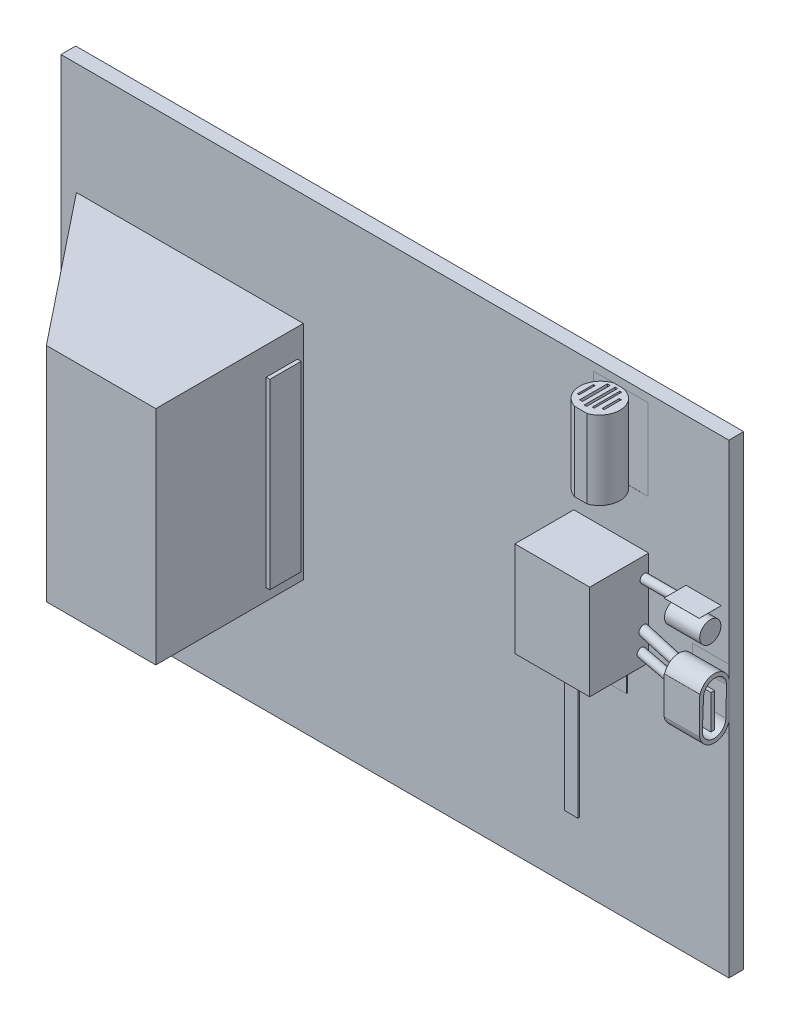
from build123d import *

# Parameters (mm, degrees)
SKETCH1_W            = 86.26612282
SKETCH1_H            = 57.862502499
BOSS_EXTRUDE1_DEPTH  = 5
SKETCH2_W            = 36.260872389
SKETCH2_H            = 45.239555314
SKETCH2_W_2          = 34.782772322
SKETCH2_H_2          = 43.550253841
BOSS_EXTRUDE2_DEPTH  = 1
SKETCH3_R            = 3.560103521
BOSS_EXTRUDE3_DEPTH  = 1
CUT_EXTRUDE2_DEPTH   = 0.5
CUT_EXTRUDE3_DEPTH   = 0.5
SKETCH11_W           = 90.581934504
SKETCH11_H           = 63.169878757
BOSS_EXTRUDE4_DEPTH  = 2
CUT_EXTRUDE11_DEPTH  = 101.321804273
CUT_EXTRUDE15_DEPTH  = 103.919917714
CUT_EXTRUDE18_DEPTH  = 107.173317368
CUT_EXTRUDE21_DEPTH  = 107.173317368
SKETCH22_W           = 30.768629045
SKETCH22_H           = 30.108187039
BOSS_EXTRUDE9_DEPTH  = 20
CUT_EXTRUDE25_DEPTH  = 30
SKETCH24_W           = 10.403591378
SKETCH24_H           = 24.347234515
CUT_EXTRUDE27_DEPTH  = 7
CUT_EXTRUDE29_DEPTH  = 101.055879455
BOSS_EXTRUDE12_DEPTH = 0.5
CUT_EXTRUDE30_DEPTH  = 0.5
SKETCH28_W           = 4.24318125
SKETCH28_H           = 24.719707094
BOSS_EXTRUDE13_DEPTH = 0.5
BOSS_EXTRUDE14_DEPTH = 0.5
BOSS_EXTRUDE15_DEPTH = 0.5
BOSS_EXTRUDE16_DEPTH = 0.5
BOSS_EXTRUDE17_DEPTH = 0.5
BOSS_EXTRUDE18_DEPTH = 0.5
BOSS_EXTRUDE19_DEPTH = 0.5
SKETCH37_W           = 4.809361554
SKETCH37_H           = 8.223826382
BOSS_EXTRUDE20_DEPTH = 4
CUT_EXTRUDE31_DEPTH  = 5
CUT_EXTRUDE32_DEPTH  = 5
CUT_EXTRUDE33_DEPTH  = 4
BOSS_EXTRUDE21_DEPTH = 4
SKETCH45_W           = 7.393024126
SKETCH45_H           = 10.623672207
BOSS_EXTRUDE24_DEPTH = 5.4
CUT_EXTRUDE47_DEPTH  = 11
CUT_EXTRUDE48_DEPTH  = 11
SKETCH55_W           = 0.338760224
SKETCH55_H           = 4.197398105
SKETCH55_W_2         = 0.38659999
SKETCH55_H_2         = 3.75171778
SKETCH55_W_3         = 0.23603713
SKETCH55_H_3         = 2.17599611
SKETCH55_W_4         = 0.254598772
SKETCH55_W_5         = 0.28217667
SKETCH55_H_4         = 2.328822457
CUT_EXTRUDE49_DEPTH  = 2
SKETCH57_W           = 4.777558033
SKETCH57_H           = 4.41992938
BOSS_EXTRUDE25_DEPTH = 3
SKETCH58_W           = 10.154057581
SKETCH58_H           = 12.884826261
BOSS_EXTRUDE26_DEPTH = 8
SKETCH60_R           = 1.436812087
CUT_EXTRUDE50_DEPTH  = 5
SKETCH65_R           = 0.579919863
SKETCH64_R           = 0.652076924
BOSS_EXTRUDE27_DEPTH = 18
SKETCH67_W           = 2.480807215
SKETCH67_H           = 0.144524976
BOSS_EXTRUDE28_DEPTH = 5
SKETCH68_R           = 0.578982331


with BuildPart() as part:
    # Sketch1 → Boss-Extrude1 (new body)
    with BuildSketch(Plane.XY):
        with Locations((-40.563374765, -16.351878859)):
            Rectangle(SKETCH1_W, SKETCH1_H)
    extrude(amount=BOSS_EXTRUDE1_DEPTH)

    # Sketch2 → Boss-Extrude2 (add)
    with BuildSketch(Plane(origin=(0, 0, 0), x_dir=(-1, 0, 0), z_dir=(0, 0, -1))):
        with Locations((32.418116178, -15.92763049)):
            Rectangle(SKETCH2_W, SKETCH2_H)
        with Locations((32.418116178, -15.92763049)):
            Rectangle(SKETCH2_W_2, SKETCH2_H_2, mode=Mode.SUBTRACT)
    extrude(amount=BOSS_EXTRUDE2_DEPTH)

    # Sketch3 → Boss-Extrude3 (add)
    with BuildSketch(Plane(origin=(0, 0, 0), x_dir=(-1, 0, 0), z_dir=(0, 0, -1))):
        with Locations((5.84715491, -15.809376146)):
            Circle(SKETCH3_R)
    extrude(amount=BOSS_EXTRUDE3_DEPTH)

    # Sketch4 → Cut-Extrude2 (cut)
    with BuildSketch(Plane(origin=(0, 0, -1), x_dir=(-1, 0, 0), z_dir=(0, 0, -1))):
        with BuildLine():
            Line((7.498244586, -13.503730374), (7.429945817, -14.22683494))
            ThreePointArc((7.429945817, -14.22683494), (3.750240849, -15.79486572), (7.319195969, -17.600830429))
            Line((7.319195969, -17.600830429), (7.313770936, -18.341402976))
            ThreePointArc((7.313770936, -18.341402976), (3.134365244, -15.759677296), (7.498244586, -13.503730374))
        make_face()
    extrude(amount=-CUT_EXTRUDE2_DEPTH, mode=Mode.SUBTRACT)

    # Sketch5 → Cut-Extrude3 (cut)
    with BuildSketch(Plane(origin=(0, 0, -1), x_dir=(-1, 0, 0), z_dir=(0, 0, -1))):
        with BuildLine():
            Line((8.340052895, -15.49291333), (5.46397868, -15.438165983))
            ThreePointArc((5.46397868, -15.438165983), (5.066360432, -15.835784231), (5.46397868, -16.233402479))
            Line((5.46397868, -16.233402479), (8.340052895, -16.178655131))
            ThreePointArc((8.340052895, -16.178655131), (8.682923796, -15.835784231), (8.340052895, -15.49291333))
        make_face()
    extrude(amount=-CUT_EXTRUDE3_DEPTH, mode=Mode.SUBTRACT)

    # Sketch11 → Boss-Extrude4 (add)
    with BuildSketch(Plane.XY.offset(5)):
        with Locations((-39.758075886, -16.772300036)):
            Rectangle(SKETCH11_W, SKETCH11_H)
    extrude(amount=BOSS_EXTRUDE4_DEPTH)

    # Sketch12 → Cut-Extrude11 (cut, through all)
    with BuildSketch(Plane(origin=(2.569686645, 0, 0), x_dir=(0, 0, -1), z_dir=(1, 0, 0))):
        Polygon((-5.049502584, 12.555506791), (1.376837193, 8.637811028), (1.49491418, 17.884962826), align=None)
    extrude(amount=-CUT_EXTRUDE11_DEPTH, mode=Mode.SUBTRACT)

    # Sketch14 → Cut-Extrude15 (cut, through all)
    with BuildSketch(Plane.ZY.offset(85.049043138)):
        Polygon((5, -45.234938719), (-1.330755584, -41.178219973), (-1.62330097, -49.506029315), align=None)
    extrude(amount=-CUT_EXTRUDE15_DEPTH, mode=Mode.SUBTRACT)

    # Sketch15 → Cut-Extrude18 (cut, through all)
    with BuildSketch(Plane(origin=(0, -48.357239414, 0), x_dir=(-1, 0, 0), z_dir=(0, -1, 0))):
        Polygon((-2.559600043, -5), (1.778800488, 1.23954643), (-4.071250311, 1.127548689), align=None)
    extrude(amount=-CUT_EXTRUDE18_DEPTH, mode=Mode.SUBTRACT)

    # Sketch19 → Cut-Extrude21 (cut, through all)
    with BuildSketch(Plane(origin=(0, -48.357239414, 0), x_dir=(-1, 0, 0), z_dir=(0, -1, 0))):
        Polygon((83.717221886, -5), (87.274615215, 1.645442207), (78.528738966, 2.746914443), align=None)
    extrude(amount=-CUT_EXTRUDE21_DEPTH, mode=Mode.SUBTRACT)

    # Sketch22 → Boss-Extrude9 (add)
    with BuildSketch(Plane.XY.offset(7)):
        with Locations((-67.568283815, -15.397372948)):
            Rectangle(SKETCH22_W, SKETCH22_H)
    extrude(amount=BOSS_EXTRUDE9_DEPTH)

    # Sketch23 → Cut-Extrude25 (cut)
    with BuildSketch(Plane(origin=(-55.481529523, 0, -37.15866109), x_dir=(-0.5564715507955287, 0, 0.8308666638848977), z_dir=(-0.8308666638848977, 0, -0.5564715507955287))):
        Polygon((50.703232917, -28.437980679), (50.703232917, -4.339059459), (35.739273575, -4.339059459), (35.739273575, -28.68631805), align=None)
    extrude(amount=-CUT_EXTRUDE25_DEPTH, mode=Mode.SUBTRACT)

    # Sketch24 → Cut-Extrude27 (cut)
    with BuildSketch(Plane(origin=(0, 0, 0), x_dir=(-1, 0, 0), z_dir=(0, 0, -1))):
        with Locations((59.023003448, -16.512676716)):
            Rectangle(SKETCH24_W, SKETCH24_H)
    extrude(amount=-CUT_EXTRUDE27_DEPTH, mode=Mode.SUBTRACT)

    # Sketch25 → Cut-Extrude29 (cut, through all)
    with BuildSketch(Plane(origin=(0, -30.451466467, 0), x_dir=(-1, 0, 0), z_dir=(0, -1, 0))):
        Polygon((67.027013916, -27), (82.952598337, -7), (82.952598337, -27), align=None)
    extrude(amount=-CUT_EXTRUDE29_DEPTH, mode=Mode.SUBTRACT)

    # Sketch26 → Boss-Extrude12 (add)
    with BuildSketch(Plane(origin=(-28.214906652, 0, 42.127625982), x_dir=(-0.8308666638848977, 0, -0.5564715507955287), z_dir=(0.5564715507955287, 0, -0.8308666638848977))):
        Polygon((51.419951496, -27.042584084), (54.706101089, -26.949653395), (56.786873834, -24.75229922), (56.786873834, -21.375630671), (54.37614932, -19.775708176), (51.378991837, -19.979195935), (49.113437408, -21.947725891), (49.198141766, -24.942981754), align=None)
    extrude(amount=BOSS_EXTRUDE12_DEPTH)

    # Sketch27 → Cut-Extrude30 (cut)
    with BuildSketch(Plane(origin=(-27.936670877, 0, 41.71219265), x_dir=(-0.8308666638848977, 0, -0.5564715507955287), z_dir=(0.5564715507955287, 0, -0.8308666638848977))):
        Polygon((54.464642231, -26.33422033), (51.646822703, -26.4613127), (49.783754686, -24.759052026), (49.783754686, -22.033008306), (51.488432075, -20.626662945), (54.098721897, -20.567022016), (56.163922733, -21.70417842), (56.231939561, -24.681054163), align=None)
        Polygon((54.320245459, -25.718387713), (51.727557218, -25.777626474), (50.570422247, -24.540605306), (50.46279432, -22.1543403), (51.442527772, -21.237877536), (54.013268601, -21.237877536), (55.47502107, -22.062626752), (55.47502107, -24.540605306), align=None, mode=Mode.SUBTRACT)
    extrude(amount=-CUT_EXTRUDE30_DEPTH, mode=Mode.SUBTRACT)

    # Sketch28 → Boss-Extrude13 (add)
    with BuildSketch(Plane(origin=(-52.183969292, 0, 0), x_dir=(0, 0, -1), z_dir=(1, 0, 0))):
        with Locations((-9.915871479, -16.49665709)):
            Rectangle(SKETCH28_W, SKETCH28_H)
    extrude(amount=BOSS_EXTRUDE13_DEPTH)

    # Sketch30 → Boss-Extrude14 (add)
    with BuildSketch(Plane(origin=(-28.214906652, 0, 42.127625982), x_dir=(-0.8308666638848977, 0, -0.5564715507955287), z_dir=(0.5564715507955287, 0, -0.8308666638848977))):
        Polygon((39.741026767, -18.492349299), (39.476828341, -15.476612632), (41.672730665, -13.439507353), (44.994030875, -13.095306184), (47.582491955, -14.918927739), (47.582491955, -17.556607895), (45.597127238, -19.83975674), (42.278609784, -20.13048076), align=None)
        Polygon((42.753379884, -19.557574971), (40.218706227, -17.915219157), (40.047543839, -15.618736631), (41.858148024, -13.995937648), (44.641069188, -13.700148309), (47.008575054, -15.234186828), (47.087554216, -17.346914718), (45.214668989, -19.374129151), align=None, mode=Mode.SUBTRACT)
    extrude(amount=BOSS_EXTRUDE14_DEPTH)

    # Sketch31 → Boss-Extrude15 (add)
    with BuildSketch(Plane(origin=(-28.214906652, 0, 42.127625982), x_dir=(-0.8308666638848977, 0, -0.5564715507955287), z_dir=(0.5564715507955287, 0, -0.8308666638848977))):
        Polygon((42.85789788, -19.001700764), (40.90866855, -17.709787086), (40.798341652, -15.935629124), (42.206204193, -14.486449171), (44.028704588, -14.267801356), (46.155315135, -15.677280073), (46.251412911, -17.222620661), (44.58854897, -18.934285698), align=None)
    extrude(amount=BOSS_EXTRUDE15_DEPTH)

    # Sketch33 → Boss-Extrude16 (add)
    with BuildSketch(Plane(origin=(-28.214906652, 0, 42.127625982), x_dir=(-0.8308666638848977, 0, -0.5564715507955287), z_dir=(0.5564715507955287, 0, -0.8308666638848977))):
        Polygon((53.503569389, -12.179269703), (50.351287483, -12.179269703), (48.150822578, -10.212614431), (48.150822578, -7.156142438), (50.250219673, -5.786553335), (53.503569389, -5.786553335), (55.514913089, -7.370681289), (55.514913089, -10.417427621), align=None)
        Polygon((53.503569389, -11.59284841), (50.538143227, -11.59284841), (48.742717543, -9.971115552), (48.610538492, -7.370681289), (50.250219673, -6.308712506), (53.323905545, -6.308712506), (54.966436414, -7.540309967), (54.966436414, -10.417427621), align=None, mode=Mode.SUBTRACT)
    extrude(amount=BOSS_EXTRUDE16_DEPTH)

    # Sketch34 → Boss-Extrude17 (add)
    with BuildSketch(Plane(origin=(-28.214906652, 0, 42.127625982), x_dir=(-0.8308666638848977, 0, -0.5564715507955287), z_dir=(0.5564715507955287, 0, -0.8308666638848977))):
        Polygon((53.106511072, -10.916807454), (50.797180111, -10.916807454), (49.238061899, -9.758322552), (49.238061899, -7.718326208), (50.364231741, -6.77238362), (52.930318743, -6.77238362), (54.187501686, -7.744761691), (54.187501686, -9.990459151), align=None)
    extrude(amount=BOSS_EXTRUDE17_DEPTH)

    # Sketch35 → Boss-Extrude18 (add)
    with BuildSketch(Plane(origin=(-28.214906652, 0, 42.127625982), x_dir=(-0.8308666638848977, 0, -0.5564715507955287), z_dir=(0.5564715507955287, 0, -0.8308666638848977))):
        Polygon((64.713370944, -17.120370272), (64.713370944, -13.869783651), (62.565543637, -12.261672552), (58.957871215, -12.261672552), (56.858934257, -14.201881127), (56.858934257, -17.199269417), (59.382404361, -19.10483149), (62.522856876, -19.10483149), align=None)
        Polygon((62.386871017, -18.403496889), (59.382404361, -18.403496889), (57.566572856, -17.046527562), (57.566572856, -14.531930934), (59.047082081, -12.865218622), (62.565543637, -12.865218622), (63.938145996, -13.890963189), (63.938145996, -16.937939256), align=None, mode=Mode.SUBTRACT)
    extrude(amount=BOSS_EXTRUDE18_DEPTH)

    # Sketch36 → Boss-Extrude19 (add)
    with BuildSketch(Plane(origin=(-28.214906652, 0, 42.127625982), x_dir=(-0.8308666638848977, 0, -0.5564715507955287), z_dir=(0.5564715507955287, 0, -0.8308666638848977))):
        Polygon((61.869690046, -17.496423291), (59.930784693, -17.496423291), (58.716123087, -16.695847313), (58.520049306, -14.729642376), (59.362877574, -13.450874134), (61.666468176, -13.450874134), (62.906032733, -14.267863494), (62.906032733, -16.375473551), align=None)
    extrude(amount=BOSS_EXTRUDE19_DEPTH)

    # Sketch37 → Boss-Extrude20 (add)
    with BuildSketch(Plane.XY.offset(7)):
        with Locations((3.163604139, -15.61606381)):
            Rectangle(SKETCH37_W, SKETCH37_H)
    extrude(amount=BOSS_EXTRUDE20_DEPTH)

    # Sketch38 → Cut-Extrude31 (cut)
    with BuildSketch(Plane(origin=(5.568284916, 0, 0), x_dir=(0, 0, -1), z_dir=(1, 0, 0))):
        with BuildLine():
            Line((-6.998744646, -13.416590654), (-7, -11.504150619))
            Line((-7, -11.504150619), (-11, -11.504150619))
            Line((-11, -11.504150619), (-10.998966698, -13.284177611))
            ThreePointArc((-10.998966698, -13.284177611), (-8.940553984, -11.589079544), (-6.998744646, -13.416590654))
        make_face()
        with BuildLine():
            Line((-11, -18.049621421), (-11, -19.727977001))
            Line((-11, -19.727977001), (-7, -19.727977001))
            Line((-7, -19.727977001), (-6.999157306, -18.072343204))
            ThreePointArc((-6.999157306, -18.072343204), (-9.009035427, -19.726127363), (-11, -18.049621421))
        make_face()
    extrude(amount=-CUT_EXTRUDE31_DEPTH, mode=Mode.SUBTRACT)

    # Sketch39 → Cut-Extrude32 (cut)
    with BuildSketch(Plane.ZY.offset(-0.758923362)):
        Polygon((10.936827336, -12.89167774), (11.556725503, -14.061865146), (12.328696781, -11.916025945), (10.891051294, -11.039468558), align=None)
    extrude(amount=-CUT_EXTRUDE32_DEPTH, mode=Mode.SUBTRACT)

    # Sketch40 → Cut-Extrude33 (cut)
    with BuildSketch(Plane(origin=(5.568284916, 0, 0), x_dir=(0, 0, -1), z_dir=(1, 0, 0))):
        with BuildLine():
            Line((-7.355000038, -13.775901449), (-7.353108221, -13.699036999))
            ThreePointArc((-7.353108221, -13.699036999), (-8.915554159, -12.136591061), (-10.478000098, -13.699036999))
            Line((-10.478000098, -13.699036999), (-10.631567168, -17.520848906))
            ThreePointArc((-10.631567168, -17.520848906), (-9.078647074, -19.187491375), (-7.449016199, -17.59577496))
            Line((-7.449016199, -17.59577496), (-7.355000038, -13.775901449))
        make_face()
    extrude(amount=-CUT_EXTRUDE33_DEPTH, mode=Mode.SUBTRACT)

    # Sketch41 → Boss-Extrude21 (add)
    with BuildSketch(Plane(origin=(1.568284916, 0, 0), x_dir=(0, 0, -1), z_dir=(1, 0, 0))):
        Polygon((-8.955256615, -13.608430616), (-8.955256615, -18.213748711), (-9.472231126, -18.213748711), (-9.472231126, -13.566180616), align=None)
    extrude(amount=BOSS_EXTRUDE21_DEPTH)

    # Sketch45 → Boss-Extrude24 (add)
    with BuildSketch(Plane.XY.offset(7)):
        with Locations((-9.116765933, 8.417842385)):
            Rectangle(SKETCH45_W, SKETCH45_H)
    extrude(amount=BOSS_EXTRUDE24_DEPTH)

    # Sketch49 → Cut-Extrude47 (cut)
    with BuildSketch(Plane(origin=(0, 13.729678488, 0), x_dir=(1, 0, 0), z_dir=(0, 1, 0))):
        with BuildLine():
            Line((-9.970080431, -6.9786998), (-12.813277996, -7))
            Line((-12.813277996, -7), (-12.813277996, -12.4))
            Line((-12.813277996, -12.4), (-9.987739862, -12.4))
            ThreePointArc((-9.987739862, -12.4), (-12.002822312, -9.682757176), (-9.970080431, -6.9786998))
        make_face()
    extrude(amount=-CUT_EXTRUDE47_DEPTH, mode=Mode.SUBTRACT)

    # Sketch54 → Cut-Extrude48 (cut)
    with BuildSketch(Plane(origin=(0, 13.729678488, 0), x_dir=(1, 0, 0), z_dir=(0, 1, 0))):
        with BuildLine():
            Line((-9.237196125, -6.984993464), (-5.42025387, -7))
            Line((-5.42025387, -7), (-5.42025387, -12.4))
            Line((-5.42025387, -12.4), (-8.282480824, -12.402237966))
            ThreePointArc((-8.282480824, -12.402237966), (-6.495890837, -9.294625887), (-9.237196125, -6.984993464))
        make_face()
    extrude(amount=-CUT_EXTRUDE48_DEPTH, mode=Mode.SUBTRACT)

    # Sketch55 → Cut-Extrude49 (cut)
    with BuildSketch(Plane(origin=(0, 13.729678488, 0), x_dir=(1, 0, 0), z_dir=(0, 1, 0))):
        with Locations((-9.324836882, -9.497813331)):
            Rectangle(SKETCH55_W, SKETCH55_H)
        with Locations((-10.215760539, -9.420732789)):
            Rectangle(SKETCH55_W_2, SKETCH55_H_2)
        with Locations((-11.147581713, -9.664069606)):
            Rectangle(SKETCH55_W_3, SKETCH55_H_3)
        with Locations((-8.572386216, -9.420732789)):
            Rectangle(SKETCH55_W_4, SKETCH55_H_2)
        with Locations((-7.730380666, -9.627691042)):
            Rectangle(SKETCH55_W_5, SKETCH55_H_4)
    extrude(amount=-CUT_EXTRUDE49_DEPTH, mode=Mode.SUBTRACT)

    # Sketch57 → Boss-Extrude25 (add)
    with BuildSketch(Plane.XY.offset(7)):
        with Locations((2.115286816, -7.344502072)):
            Rectangle(SKETCH57_W, SKETCH57_H)
    extrude(amount=BOSS_EXTRUDE25_DEPTH)

    # Sketch58 → Boss-Extrude26 (add)
    with BuildSketch(Plane.XY.offset(7)):
        with Locations((-10.419598604, -10.326811999)):
            Rectangle(SKETCH58_W, SKETCH58_H)
    extrude(amount=BOSS_EXTRUDE26_DEPTH)

    # Sketch60 → Cut-Extrude50 (cut)
    with BuildSketch(Plane(origin=(4.504065832, 0, 0), x_dir=(0, 0, -1), z_dir=(1, 0, 0))):
        Polygon((-7, -9.554466762), (-10, -9.554466762), (-10, -5.138750247), (-7, -5.134537382), align=None)
        with Locations((-8.49107236, -7.472850849)):
            Circle(SKETCH60_R, mode=Mode.SUBTRACT)
    extrude(amount=-CUT_EXTRUDE50_DEPTH, mode=Mode.SUBTRACT)


with BuildPart() as cut_extrude50_piece_1:
    # of the separate pieces the step leaves, piece 1, a body of its own (cut_extrude50_pieces)
    add(part.part.solids().sort_by_distance((-85.049043138, -48.357239414, 5))[0])

    # Sweep4: sweep along a curve in space
    with BuildLine() as sweep4_path:
        Line((0.758923362, -16.867131615, 7.674883111), (-5.384955785, -15.035155844, 7.988542387))
    # Sketch65 → Sweep4 (sweep)
    with BuildSketch(Plane.ZY.offset(-0.758923362)):
        with Locations((7.674883111, -16.867131615)):
            Circle(SKETCH65_R)
    sweep(path=sweep4_path.line)

    # Sweep5: sweep along a curve in space
    with BuildLine() as sweep5_path:
        Line((0.758923362, -14.369472706, 7.687891326), (-5.570587917, -12.537302357, 7.678470629))
    # Sketch64 → Sweep5 (sweep)
    with BuildSketch(Plane.ZY.offset(-0.758923362)):
        with Locations((7.687891326, -14.369472706)):
            Circle(SKETCH64_R)
    sweep(path=sweep5_path.line)

    # Sketch66 → Boss-Extrude27 (add)
    with BuildSketch(Plane(origin=(0, -16.769225129, 0), x_dir=(-1, 0, 0), z_dir=(0, -1, 0))):
        Polygon((9.859376709, -12.080961629), (9.859376709, -11.887900888), (11.722831442, -11.887900888), (11.722831442, -12.039184925), align=None)
    extrude(amount=BOSS_EXTRUDE27_DEPTH)

    # Sketch67 → Boss-Extrude28 (add)
    with BuildSketch(Plane(origin=(0, -16.769225129, 0), x_dir=(-1, 0, 0), z_dir=(0, -1, 0))):
        with Locations((9.459348433, -7.072262488)):
            Rectangle(SKETCH67_W, SKETCH67_H)
    extrude(amount=BOSS_EXTRUDE28_DEPTH)



with BuildPart() as cut_extrude50_piece_2:
    # of the separate pieces the step leaves, piece 2, a body of its own (cut_extrude50_pieces)
    add(part.part.solids().sort_by_distance((4.504065832, -7.472850849, 7.054260273))[0])


with BuildPart() as cut_extrude50_piece_3:
    # of the separate pieces the step leaves, piece 3, a body of its own (cut_extrude50_pieces)
    add(part.part.solids().sort_by_distance((-0.273492201, -5.134537382, 10))[0])


with BuildPart() as cut_extrude50_piece_1_1:
    add(cut_extrude50_piece_1.part)

    add(cut_extrude50_piece_2.part)  # Sweep8 merges Cut-Extrude50 piece 2
    # Sweep8: sweep along a curve in space
    with BuildLine() as sweep8_path:
        Line((-5.342569813, -6.564862184, 7.593202135), (0.95456001, -6.564862184, 7.593202135))
    # Sketch68 → Sweep8 (sweep)
    with BuildSketch(Plane(origin=(-5.342569813, 0, 0), x_dir=(0, 0, -1), z_dir=(1, 0, 0))):
        with Locations((-7.593202135, -6.564862184)):
            Circle(SKETCH68_R)
    sweep(path=sweep8_path.line)


solid = Compound([cut_extrude50_piece_3.part, cut_extrude50_piece_1_1.part])
